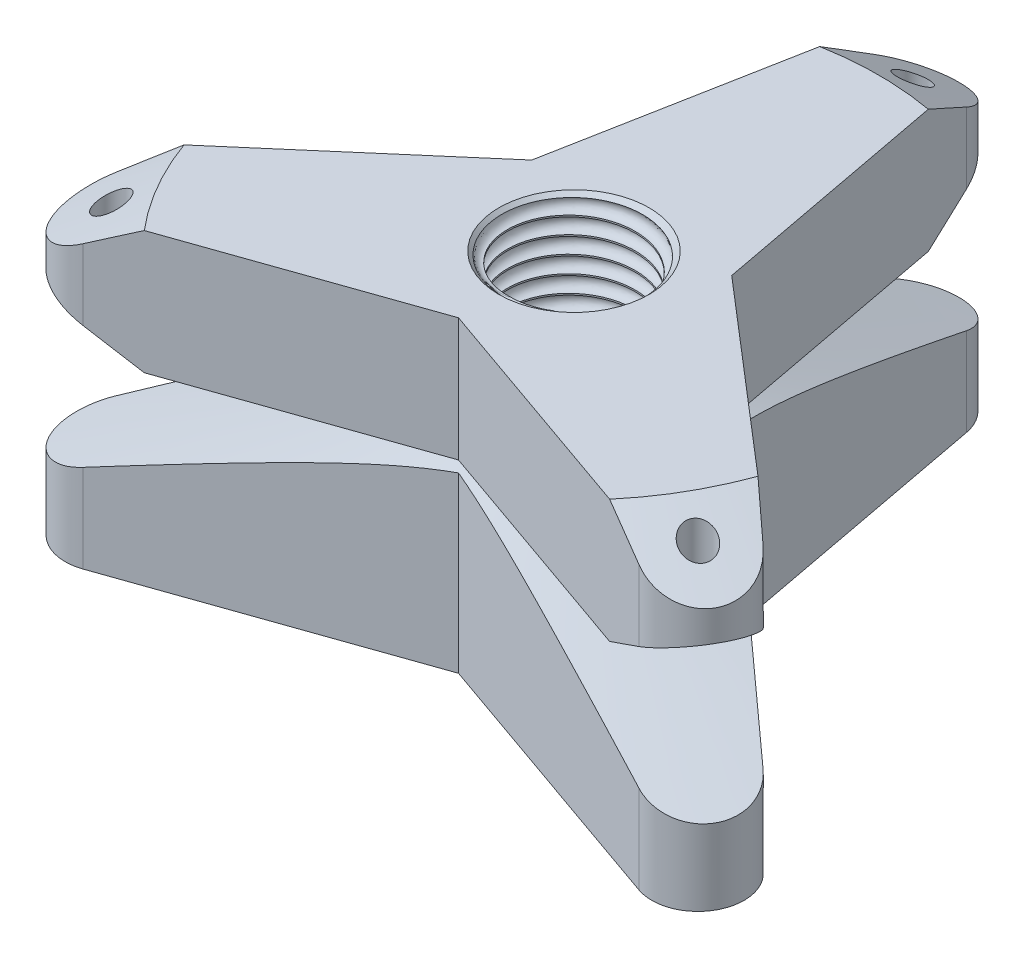
from build123d import *

# Parameters (mm, degrees)
SKETCH1_R               = 4.15
BOSS_EXTRUDE1_DEPTH     = 20
SKETCH62_R              = 4.881214272
CUT_EXTRUDE4_DEPTH      = 0.5
CUT_EXTRUDE4_DRAFT      = -45
SKETCH1_10_R            = 1
CUT_EXTRUDE6_DEPTH      = 10
CUT_SWEEP4_PITCH        = 1.1
CUT_SWEEP5_PITCH        = 1.1
SKETCH98_R              = 5.062256421
SKETCH98_R_2            = 2.5
BOSS_EXTRUDE2_DEPTH     = 3
CUT_SWEEP6_PROFILE_R    = 1.5
CIRPATTERN1_COUNT       = 3
MIRROR2_COPY_1_SKETCH_R = 4.881214272
MIRROR2_COPY_1_DEPTH    = 0.5
MIRROR2_COPY_1_DRAFT    = -45


with BuildPart() as part:
    # Sketch1 → Boss-Extrude1 (new body)
    with BuildSketch(Plane(origin=(0, 0, 0), x_dir=(1, 0, 0), z_dir=(0, 1, 0))):
        with BuildLine():
            Line((-2.948017472, 22.556051242), (-6.495190528, 3.75))
            Line((-6.495190528, 3.75), (-21.008122121, -8.724967599))
            ThreePointArc((-21.008122121, -8.724967599), (-21.650635095, -12.5), (-18.060104648, -13.831083643))
            Line((-18.060104648, -13.831083643), (0, -7.5))
            Line((0, -7.5), (18.060104648, -13.831083643))
            ThreePointArc((18.060104648, -13.831083643), (21.650635095, -12.5), (21.008122121, -8.724967599))
            Line((21.008122121, -8.724967599), (6.495190528, 3.75))
            Line((6.495190528, 3.75), (2.948017472, 22.556051242))
            ThreePointArc((2.948017472, 22.556051242), (0, 25), (-2.948017472, 22.556051242))
        make_face()
        with Locations(Location((0, 0, 0), (0, 0, 270))):
            Circle(SKETCH1_R, mode=Mode.SUBTRACT)
    extrude(amount=-BOSS_EXTRUDE1_DEPTH)


with BuildPart() as cut_extrude4_tool:
    # Sketch62 → Cut-Extrude4 (with draft: the straight prism first)
    with BuildSketch(Plane(origin=(0, 0, 0), x_dir=(1, 0, 0), z_dir=(0, 1, 0))):
        Circle(SKETCH62_R)
    extrude(amount=-CUT_EXTRUDE4_DEPTH)
    # Cut-Extrude4: the draft: its side faces are tilted about the plane it starts from
    cut_extrude4_sides = [cut_extrude4_tool.faces().sort_by_distance(p)[0] for p in [
        (-4.881214272, -0.25, 0),
    ]]
    draft(cut_extrude4_sides, Plane(origin=(0, 0, 0), x_dir=(1, 0, 0), z_dir=(0, 1, 0)), CUT_EXTRUDE4_DRAFT)


with BuildPart() as part_1:
    add(part.part)

    # Cut-Extrude4: cut by cut_extrude4_tool
    add(cut_extrude4_tool.part, mode=Mode.SUBTRACT)

    # Sketch74 → Cut-Revolve1 (revolve, cut)
    with BuildSketch(Plane(origin=(0, 0, 0), x_dir=(0, 0, -1), z_dir=(1, 0, 0)), mode=Mode.PRIVATE) as cut_revolve1_sk:
        Polygon((25, 0), (19.803847577, 0), (25, -3), align=None)
    cut_revolve1 = revolve(cut_revolve1_sk.sketch.rotate(Axis((0, 0, 0), (0, -1, 0)), 180), axis=Axis((0, 0, 0), (0, -1, 0)), mode=Mode.SUBTRACT)

    # Sketch1<10> → Cut-Extrude6 (cut)
    with BuildSketch(Plane(origin=(0, 0, 0), x_dir=(1, 0, 0), z_dir=(0, 1, 0))):
        with Locations(Location((-19.052558883, -11, 0), (0, 0, 270))):
            Circle(SKETCH1_10_R)
        with Locations(Location((19.052558883, -11, 0), (0, 0, 270))):
            Circle(SKETCH1_10_R)
        with Locations(Location((0, 22, 0), (0, 0, 270))):
            Circle(SKETCH1_10_R)
    extrude(amount=-CUT_EXTRUDE6_DEPTH, mode=Mode.SUBTRACT)

    # Mirror1: Cut-Revolve1 across plane
    add(cut_revolve1.mirror(Plane.ZX.offset(-4)), mode=Mode.SUBTRACT)

    # Cut-Sweep4: arcs per turn and ends read off the stored shape
    # Cut-Sweep4: the profile of Cut-Sweep4 profile screwed along a right-hand helix through 7 turns, 8 arcs to a turn; built about Z, then put on its axis
    cut_sweep4_z = Axis((0, 0, 0), (0, 0, 1))
    cut_sweep4_corners = [(4.15, -0.02107408, 0.499555686), (4.65, 0, 0), (4.15, 0.02107408, -0.499555686), (3.65, 0, 0)]
    with BuildLine(mode=Mode.PRIVATE) as cut_sweep4_profile:
        ThreePointArc((4.15, -0.02107408, 0.499555686), (4.503553391, -0.014901625, 0.353239213), (4.65, 0, 0))
        ThreePointArc((4.65, 0, 0), (4.503553391, 0.014901625, -0.353239213), (4.15, 0.02107408, -0.499555686))
        ThreePointArc((4.15, 0.02107408, -0.499555686), (3.796446609, 0.014901625, -0.353239213), (3.65, 0, 0))
        ThreePointArc((3.65, 0, 0), (3.796446609, -0.014901625, 0.353239213), (4.15, -0.02107408, 0.499555686))
    cut_sweep4_cap = Face(cut_sweep4_profile.wire())
    cut_sweep4_arcs = [((4.15, -0.02107408, 0.499555686), (4.65, -0.02107408, 0.499555686), (4.65, 0, 0), (1, 0.7071067811865476, 1)), ((4.65, 0, 0), (4.65, 0.02107408, -0.499555686), (4.15, 0.02107408, -0.499555686), (1, 0.7071067811865476, 1)), ((4.15, 0.02107408, -0.499555686), (3.65, 0.02107408, -0.499555686), (3.65, 0, 0), (1, 0.7071067811865476, 1)), ((3.65, 0, 0), (3.65, -0.02107408, 0.499555686), (4.15, -0.02107408, 0.499555686), (1, 0.7071067811865476, 1))]  # start, shoulder, end, weights
    cut_sweep4_turn_angles = [0, 22.5, 45, 67.5, 90, 112.5, 135, 157.5, 180, 202.5, 225, 247.5, 270, 292.5, 315, 337.5, 360]
    cut_sweep4_turn_weights = [1, 0.9238795325112867, 1, 0.9238795325112867, 1, 0.9238795325112867, 1, 0.9238795325112867, 1, 0.9238795325112867, 1, 0.9238795325112867, 1, 0.9238795325112867, 1, 0.9238795325112867, 1]
    cut_sweep4_turn_sides = [Face.make_bezier_surface([[Vector(p[j][0], p[j][1], 0).rotate(cut_sweep4_z, cut_sweep4_turn_angles[2 * i + k]) / cut_sweep4_turn_weights[2 * i + k] + Vector(0, 0, p[j][2] + CUT_SWEEP4_PITCH * cut_sweep4_turn_angles[2 * i + k] / 360) for k in range(3)] for j in range(3)], [[p[3][j] * cut_sweep4_turn_weights[2 * i + k] for k in range(3)] for j in range(3)]) for p in cut_sweep4_arcs for i in range(8)]
    cut_sweep4 = Plane(origin=(0, 0, 0), x_dir=(0, 0, 1), z_dir=(0, -1, 0)) * Solid(Shell([*[p.moved(Location((0, 0, CUT_SWEEP4_PITCH * i))) for i in range(7) for p in cut_sweep4_turn_sides], cut_sweep4_cap, cut_sweep4_cap.rotate(cut_sweep4_z, 2520).moved(Location((0, 0, CUT_SWEEP4_PITCH * 2520 / 360)))]))
    add(cut_sweep4, mode=Mode.SUBTRACT)

    # Cut-Sweep5: arcs per turn and ends read off the stored shape
    # Cut-Sweep5: the profile of Cut-Sweep5 profile screwed along a right-hand helix through 8 turns, 8 arcs to a turn; built about Z, then put on its axis
    cut_sweep5_z = Axis((0, 0, 0), (0, 0, 1))
    cut_sweep5_corners = [(4.15, 0.02107408, -1.599555686), (3.65, 0, -1.1), (4.15, -0.02107408, -0.600444314), (4.65, 0, -1.1)]
    with BuildLine(mode=Mode.PRIVATE) as cut_sweep5_profile:
        ThreePointArc((4.15, 0.02107408, -1.599555686), (3.796446609, 0.014901625, -1.453239213), (3.65, 0, -1.1))
        ThreePointArc((3.65, 0, -1.1), (3.796446609, -0.014901625, -0.746760787), (4.15, -0.02107408, -0.600444314))
        ThreePointArc((4.15, -0.02107408, -0.600444314), (4.503553391, -0.014901625, -0.746760787), (4.65, 0, -1.1))
        ThreePointArc((4.65, 0, -1.1), (4.503553391, 0.014901625, -1.453239213), (4.15, 0.02107408, -1.599555686))
    cut_sweep5_cap = Face(cut_sweep5_profile.wire())
    cut_sweep5_arcs = [((4.15, 0.02107408, -1.599555686), (3.65, 0.02107408, -1.599555686), (3.65, 0, -1.1), (1, 0.7071067811865476, 1)), ((3.65, 0, -1.1), (3.65, -0.02107408, -0.600444314), (4.15, -0.02107408, -0.600444314), (1, 0.7071067811865476, 1)), ((4.15, -0.02107408, -0.600444314), (4.65, -0.02107408, -0.600444314), (4.65, 0, -1.1), (1, 0.7071067811865476, 1)), ((4.65, 0, -1.1), (4.65, 0.02107408, -1.599555686), (4.15, 0.02107408, -1.599555686), (1, 0.7071067811865476, 1))]  # start, shoulder, end, weights
    cut_sweep5_turn_angles = [0, 22.5, 45, 67.5, 90, 112.5, 135, 157.5, 180, 202.5, 225, 247.5, 270, 292.5, 315, 337.5, 360]
    cut_sweep5_turn_weights = [1, 0.9238795325112867, 1, 0.9238795325112867, 1, 0.9238795325112867, 1, 0.9238795325112867, 1, 0.9238795325112867, 1, 0.9238795325112867, 1, 0.9238795325112867, 1, 0.9238795325112867, 1]
    cut_sweep5_turn_sides = [Face.make_bezier_surface([[Vector(p[j][0], p[j][1], 0).rotate(cut_sweep5_z, cut_sweep5_turn_angles[2 * i + k]) / cut_sweep5_turn_weights[2 * i + k] + Vector(0, 0, p[j][2] + CUT_SWEEP5_PITCH * cut_sweep5_turn_angles[2 * i + k] / 360) for k in range(3)] for j in range(3)], [[p[3][j] * cut_sweep5_turn_weights[2 * i + k] for k in range(3)] for j in range(3)]) for p in cut_sweep5_arcs for i in range(8)]
    cut_sweep5 = Plane(origin=(0, -20, 0), x_dir=(0, 0, -1), z_dir=(0, 1, 0)) * Solid(Shell([*[p.moved(Location((0, 0, CUT_SWEEP5_PITCH * i))) for i in range(8) for p in cut_sweep5_turn_sides], cut_sweep5_cap, cut_sweep5_cap.rotate(cut_sweep5_z, 2880).moved(Location((0, 0, CUT_SWEEP5_PITCH * 2880 / 360)))]))
    add(cut_sweep5, mode=Mode.SUBTRACT)

    # Sketch95 → Cut-Revolve2 (revolve, cut)
    with BuildSketch(Plane(origin=(0, 0, 0), x_dir=(0, 0, -1), z_dir=(1, 0, 0)), mode=Mode.PRIVATE) as cut_revolve2_sk:
        Polygon((25, -8), (5.5, -8), (25, -15.097419568), align=None)
    revolve(cut_revolve2_sk.sketch.rotate(Axis((0, 0, 0), (0, -1, 0)), 179.862340269), axis=Axis((0, 0, 0), (0, -1, 0)), mode=Mode.SUBTRACT)

    # Sketch98 → Boss-Extrude2 (add, symmetric)
    with BuildSketch(Plane(origin=(0, -10, 0), x_dir=(1, 0, 0), z_dir=(0, 1, 0))):
        Circle(SKETCH98_R)
        with Locations(Location((0, 0, 0), (0, 0, 270))):
            Circle(SKETCH98_R_2, mode=Mode.SUBTRACT)
    extrude(amount=BOSS_EXTRUDE2_DEPTH, both=True)

    # Cut-Sweep6: sweep along a path in Sketch94
    with BuildLine(Plane(origin=(0, 0, 0), x_dir=(0, 0, -1), z_dir=(1, 0, 0))) as cut_sweep6_path:
        Line((1.5, -10), (19.96943156, -16.306635167))
        ThreePointArc((19.96943156, -16.306635167), (21.440112157, -17.400447599), (22, -19.145684735))
        Line((22, -19.145684735), (22, -20))
    # Cut-Sweep6 profile (on start of the path) → Cut-Sweep6 (sweep, cut)
    with BuildSketch(Plane(origin=(0, -10, -1.5), x_dir=(0, -0.946349856067995, 0.3231438532915103), z_dir=(0, -0.3231438532915103, -0.946349856067995))):
        Circle(CUT_SWEEP6_PROFILE_R)
    cut_sweep6 = sweep(path=cut_sweep6_path.line, mode=Mode.SUBTRACT)

    # CirPattern1: Cut-Sweep6 ×3 about axis
    cirpattern1_axis = Axis((0, 0, 0), (0, 1, 0))
    for i in range(1, CIRPATTERN1_COUNT):
        add(cut_sweep6.rotate(cirpattern1_axis, i * 360 / CIRPATTERN1_COUNT), mode=Mode.SUBTRACT)


with BuildPart() as mirror2_copy_1_tool:
    # Mirror2 copy 1 sketch → Mirror2 copy 1 (with draft: the straight prism first)
    with BuildSketch(Plane.XZ.offset(20)):
        Circle(MIRROR2_COPY_1_SKETCH_R)
    extrude(amount=-MIRROR2_COPY_1_DEPTH)
    # Mirror2 copy 1: the draft: its side faces are tilted about the plane it starts from
    mirror2_copy_1_sides = [mirror2_copy_1_tool.faces().sort_by_distance(p)[0] for p in [
        (-4.881214272, -19.75, 0),
    ]]
    draft(mirror2_copy_1_sides, Plane.XZ.offset(20), MIRROR2_COPY_1_DRAFT)


with BuildPart() as part_2:
    add(part_1.part)

    # Mirror2 copy 1: cut by mirror2_copy_1_tool
    add(mirror2_copy_1_tool.part, mode=Mode.SUBTRACT)


solid = part_2.part
